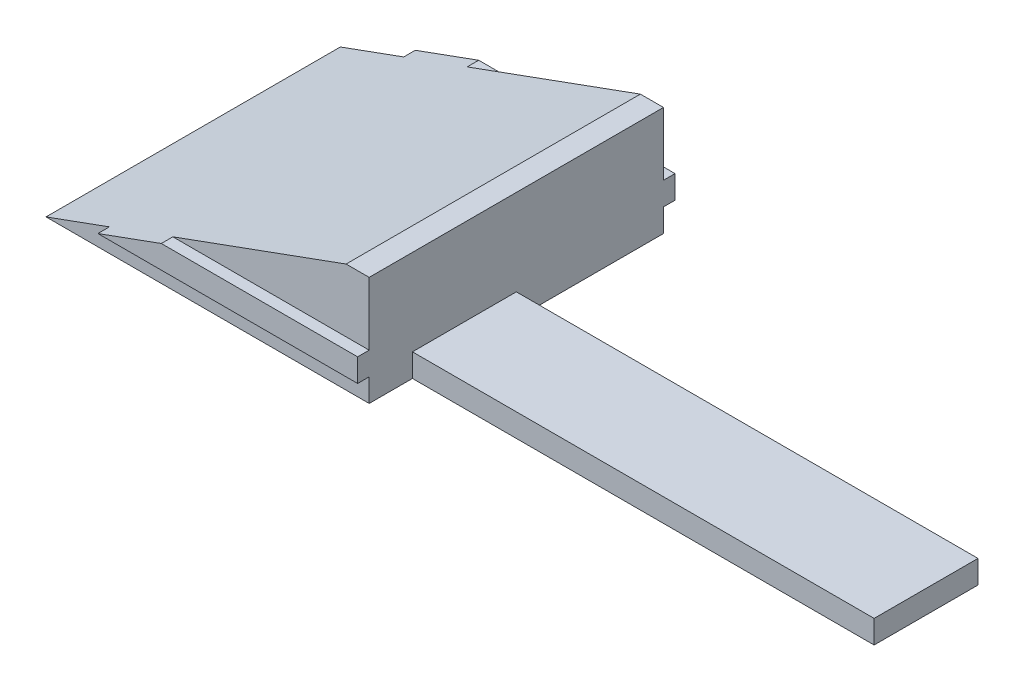
from build123d import *

# Parameters (mm, degrees)
SKETCH1_W           = 26
SKETCH1_H           = 25.5
BOSS_EXTRUDE1_DEPTH = 9.463
SKETCH2_W           = 26
SKETCH2_H           = 2
BOSS_EXTRUDE3_DEPTH = 1
SKETCH3_W           = 26
SKETCH3_H           = 2
BOSS_EXTRUDE4_DEPTH = 1
CHAMFER2_SIZE       = 9.463
CHAMFER2_SIZE_2     = 25.99937882
BOSS_EXTRUDE5_DEPTH = 2
SKETCH5_W           = 9
SKETCH5_H           = 2
BOSS_EXTRUDE6_DEPTH = 40


with BuildPart() as part:
    # Sketch1 → Boss-Extrude1 (new body)
    with BuildSketch(Plane(origin=(0, 0, 0), x_dir=(1, 0, 0), z_dir=(0, 1, 0))):
        Rectangle(SKETCH1_W, SKETCH1_H)
    extrude(amount=BOSS_EXTRUDE1_DEPTH)

    # Sketch2 → Boss-Extrude3 (add)
    with BuildSketch(Plane.XY.offset(12.75)):
        with Locations((0, 3)):
            Rectangle(SKETCH2_W, SKETCH2_H)
    extrude(amount=BOSS_EXTRUDE3_DEPTH)

    # Sketch3 → Boss-Extrude4 (add)
    with BuildSketch(Plane(origin=(0, 0, -12.75), x_dir=(-1, 0, 0), z_dir=(0, 0, -1))):
        with Locations((0, 3)):
            Rectangle(SKETCH3_W, SKETCH3_H)
    extrude(amount=BOSS_EXTRUDE4_DEPTH)

    # Chamfer2
    # the kernel refuses this chamfer: 25.99937882, 9.463 mm, written as the material it takes off along each edge
    with BuildSketch(Plane(origin=(-13, 9.463, -80.197451585), x_dir=(-0.09904090225205063, -0.9950833631817486, 0), z_dir=(0, 0, 1))) as chamfer2_piece_1:
        Polygon((CHAMFER2_SIZE * 0.995083363182, CHAMFER2_SIZE * 0.0990409022521), (-CHAMFER2_SIZE_2 * 0.0990409022532, CHAMFER2_SIZE_2 * 0.995083363193), (0, 0), align=None)
    extrude(amount=160.39490317, mode=Mode.SUBTRACT)

    # Sketch4 → Boss-Extrude5 (add)
    with BuildSketch(Plane(origin=(13, 0, 0), x_dir=(0, 0, -1), z_dir=(1, 0, 0))):
        Polygon((-12.75, 0), (12.75, 0), (12.75, 2), (13.75, 2), (13.75, 4), (12.75, 4), (12.75, 9.463), (-12.75, 9.463), (-12.75, 4), (-13.75, 4), (-13.75, 2), (-12.75, 2), align=None)
    extrude(amount=BOSS_EXTRUDE5_DEPTH)

    # Sketch5 → Boss-Extrude6 (add)
    with BuildSketch(Plane(origin=(15, 0, 0), x_dir=(0, 0, -1), z_dir=(1, 0, 0))):
        with Locations((-4.5, 1)):
            Rectangle(SKETCH5_W, SKETCH5_H)
    extrude(amount=BOSS_EXTRUDE6_DEPTH)


solid = part.part
